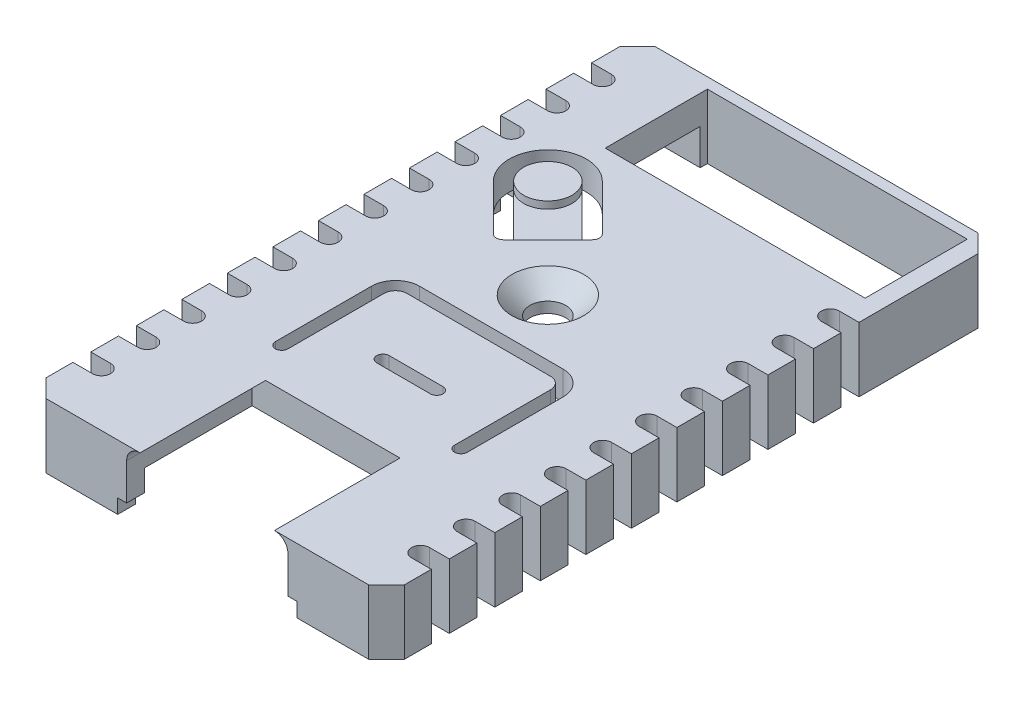
from build123d import *

# Parameters (mm, degrees)
BASES_W                  = 20
BASES_H                  = 34
BASE_DEPTH               = 1.6
BASECHAMFER_SIZE         = 1
SIDEWALL_DEPTH           = 2
ANTENNAACCESSS_W         = 14.5
ANTENNAACCESSS_H         = 5.7
ANTENNAACCESS_DEPTH      = 21.048940122
PINACCESS_DEPTH          = 21.048940122
PALP_COUNT               = 12
PALP_PITCH               = 2.54
RIGHTSIDEPINACCESS_DEPTH = 21.048940122
RSPALP_COUNT             = 10
RSPALP_PITCH             = 2.54
FASTENINGHOLES_R         = 1
FASTENINGHOLE_DEPTH      = 21.048940122
MIDSLIT_DEPTH            = 21.048940122
HALFCURVEDSLIT_DEPTH     = 21.048940122
BUTTONSLIT_DEPTH         = 21.048940122
BUTTONTABCUT_DEPTH       = 0.4
USBPORTACCESS_DEPTH      = 7
BTCC_SIZE                = 0.4
FHC_SIZE                 = 1


with BuildPart() as part:
    # BaseS → Base (new body)
    with BuildSketch(Plane(origin=(0, 0, 0), x_dir=(1, 0, 0), z_dir=(0, 1, 0))):
        Rectangle(BASES_W, BASES_H)
    extrude(amount=-BASE_DEPTH)

    # BaseChamfer
    basechamfer_edges = [part.edges().sort_by_distance(p)[0] for p in [
        (10, -0.8, 17),
        (-10, -0.8, 17),
        (-10, -0.8, -17),
        (10, -0.8, -17),
    ]]
    chamfer(basechamfer_edges, length=BASECHAMFER_SIZE)

    # SideWallS → SideWall (add)
    with BuildSketch(Plane.XZ.offset(1.6)):
        Polygon((9, 17), (-9, 17), (-10, 16), (-10, -16), (-9, -17), (9, -17), (10, -16), (10, 16), align=None)
        Polygon((-9, 15.585786438), (-9, -15.585786438), (-8.585786438, -16), (8.585786438, -16), (9, -15.585786438), (9, 15.585786438), (8.585786438, 16), (-8.585786438, 16), align=None, mode=Mode.SUBTRACT)
    extrude(amount=SIDEWALL_DEPTH)

    # AntennaAccessS → AntennaAccess (cut, through all)
    with BuildSketch(Plane(origin=(0, 0, 0), x_dir=(1, 0, 0), z_dir=(0, 1, 0))):
        with Locations((1.75, 13.55)):
            Rectangle(ANTENNAACCESSS_W, ANTENNAACCESSS_H)
    extrude(amount=-ANTENNAACCESS_DEPTH, mode=Mode.SUBTRACT)

    # PinAccessS → PinAccess (cut, through all)
    with BuildSketch(Plane(origin=(0, 0, 0), x_dir=(1, 0, 0), z_dir=(0, 1, 0))):
        with BuildLine():
            Line((-8.9, -14.5), (-10, -14.5))
            ThreePointArc((-10, -14.5), (-10.5, -14), (-10, -13.5))
            Line((-10, -13.5), (-8.9, -13.5))
            ThreePointArc((-8.9, -13.5), (-8.4, -14), (-8.9, -14.5))
        make_face()
    pinaccess = extrude(amount=-PINACCESS_DEPTH, mode=Mode.SUBTRACT)

    # PALP: PinAccess ×12
    with Locations(*[(0, 0, -i * PALP_PITCH) for i in range(1, PALP_COUNT)]):
        add(pinaccess, mode=Mode.SUBTRACT)

    # RightSidePinAccessS → RightSidePinAccess (cut, through all)
    with BuildSketch(Plane(origin=(0, 0, 0), x_dir=(1, 0, 0), z_dir=(0, 1, 0))):
        with BuildLine():
            Line((8.9, -14.5), (10, -14.5))
            ThreePointArc((10, -14.5), (10.5, -14), (10, -13.5))
            Line((10, -13.5), (8.9, -13.5))
            ThreePointArc((8.9, -13.5), (8.4, -14), (8.9, -14.5))
        make_face()
    rightsidepinaccess = extrude(amount=-RIGHTSIDEPINACCESS_DEPTH, mode=Mode.SUBTRACT)

    # RSPALP: RightSidePinAccess ×10
    with Locations(*[(0, 0, -i * RSPALP_PITCH) for i in range(1, RSPALP_COUNT)]):
        add(rightsidepinaccess, mode=Mode.SUBTRACT)

    # FasteningHoleS → FasteningHole (cut, through all)
    with BuildSketch(Plane(origin=(0, 0, 0), x_dir=(1, 0, 0), z_dir=(0, 1, 0))):
        with Locations(Location((0, 2, 0), (0, 0, 270))):
            Circle(FASTENINGHOLES_R)
    extrude(amount=-FASTENINGHOLE_DEPTH, mode=Mode.SUBTRACT)

    # MidSlitS → MidSlit (cut, through all)
    with BuildSketch(Plane(origin=(0, 0, 0), x_dir=(1, 0, 0), z_dir=(0, 1, 0))):
        with BuildLine():
            Line((-1.5, -5.35), (1.5, -5.35))
            ThreePointArc((1.5, -5.35), (1.85, -5.7), (1.5, -6.05))
            Line((1.5, -6.05), (-1.5, -6.05))
            ThreePointArc((-1.5, -6.05), (-1.85, -5.7), (-1.5, -5.35))
        make_face()
    extrude(amount=-MIDSLIT_DEPTH, mode=Mode.SUBTRACT)

    # HalfCurvedSlitS → HalfCurvedSlit (cut, through all)
    with BuildSketch(Plane(origin=(0, 0, 0), x_dir=(1, 0, 0), z_dir=(0, 1, 0))):
        with BuildLine():
            Line((-4.65, -7.85), (-4.65, -2.5))
            ThreePointArc((-4.65, -2.5), (-4.459619408, -2.040380592), (-4, -1.85))
            Line((-4, -1.85), (0, -1.85))
            ThreePointArc((0, -1.85), (0.35, -1.5), (0, -1.15))
            Line((0, -1.15), (-4, -1.15))
            ThreePointArc((-4, -1.15), (-4.954594155, -1.545405845), (-5.35, -2.5))
            Line((-5.35, -2.5), (-5.35, -7.85))
            ThreePointArc((-5.35, -7.85), (-5, -8.2), (-4.65, -7.85))
        make_face()
    halfcurvedslit = extrude(amount=-HALFCURVEDSLIT_DEPTH, mode=Mode.SUBTRACT)

    # HCSHM: HalfCurvedSlit across plane
    add(halfcurvedslit.mirror(Plane(origin=(0, 0, 0), x_dir=(0, 0, 1), z_dir=(1, 0, 0))), mode=Mode.SUBTRACT)

    # ButtonSlitS → ButtonSlit (cut, through all)
    with BuildSketch(Plane(origin=(0, 0, 0), x_dir=(1, 0, 0), z_dir=(0, 1, 0))):
        with BuildLine():
            Line((-3.97972042, 9.02027958), (-1.434136008, 6.474695167))
            ThreePointArc((-1.434136008, 6.474695167), (-1.434136008, 5.909009742), (-1.999821433, 5.909009742))
            Line((-1.999821433, 5.909009742), (-4.545405845, 8.454594155))
            ThreePointArc((-4.545405845, 8.454594155), (-6.454594155, 8.454594155), (-6.454594155, 6.545405845))
            Line((-6.454594155, 6.545405845), (-3.909009742, 3.999821433))
            ThreePointArc((-3.909009742, 3.999821433), (-3.909009742, 3.434136008), (-4.474695167, 3.434136008))
            Line((-4.474695167, 3.434136008), (-7.02027958, 5.97972042))
            ThreePointArc((-7.02027958, 5.97972042), (-7.02027958, 9.02027958), (-3.97972042, 9.02027958))
        make_face()
    extrude(amount=-BUTTONSLIT_DEPTH, mode=Mode.SUBTRACT)

    # ButtonTabCutS → ButtonTabCut (cut)
    with BuildSketch(Plane(origin=(0, 0, 0), x_dir=(1, 0, 0), z_dir=(0, 1, 0))):
        with BuildLine():
            Line((-4.545405845, 8.454594155), (-1.999821433, 5.909009742))
            Line((-1.999821433, 5.909009742), (-3.909009742, 3.999821433))
            Line((-3.909009742, 3.999821433), (-6.454594155, 6.545405845))
            ThreePointArc((-6.454594155, 6.545405845), (-4.545405845, 6.545405845), (-4.545405845, 8.454594155))
        make_face()
    extrude(amount=-BUTTONTABCUT_DEPTH, mode=Mode.SUBTRACT)

    # USBPortAccessS → USBPortAccess (cut)
    with BuildSketch(Plane.XY.offset(17)):
        with BuildLine():
            Line((3.75, 0), (-3.75, 0))
            ThreePointArc((-3.75, 0), (-4.280330086, -0.219669914), (-4.5, -0.75))
            Line((-4.5, -0.75), (-4.5, -2.8))
            Line((-4.5, -2.8), (-5, -2.8))
            Line((-5, -2.8), (-5, -3.6))
            Line((-5, -3.6), (5, -3.6))
            Line((5, -3.6), (5, -2.8))
            Line((5, -2.8), (4.5, -2.8))
            Line((4.5, -2.8), (4.5, -0.75))
            ThreePointArc((4.5, -0.75), (4.280330086, -0.219669914), (3.75, 0))
        make_face()
    extrude(amount=-USBPORTACCESS_DEPTH, mode=Mode.SUBTRACT)

    # BTCC
    btcc_edges = [part.edges().sort_by_distance(p)[0] for p in [
        (-2.954415588, 0, -4.954415588),
    ]]
    chamfer(btcc_edges, length=BTCC_SIZE - 0.0001)  # a hair under: the kernel refuses the full size

    # FHC
    fhc_edges = [part.edges().sort_by_distance(p)[0] for p in [
        (0, 0, -3),
    ]]
    chamfer(fhc_edges, length=FHC_SIZE)


solid = part.part
